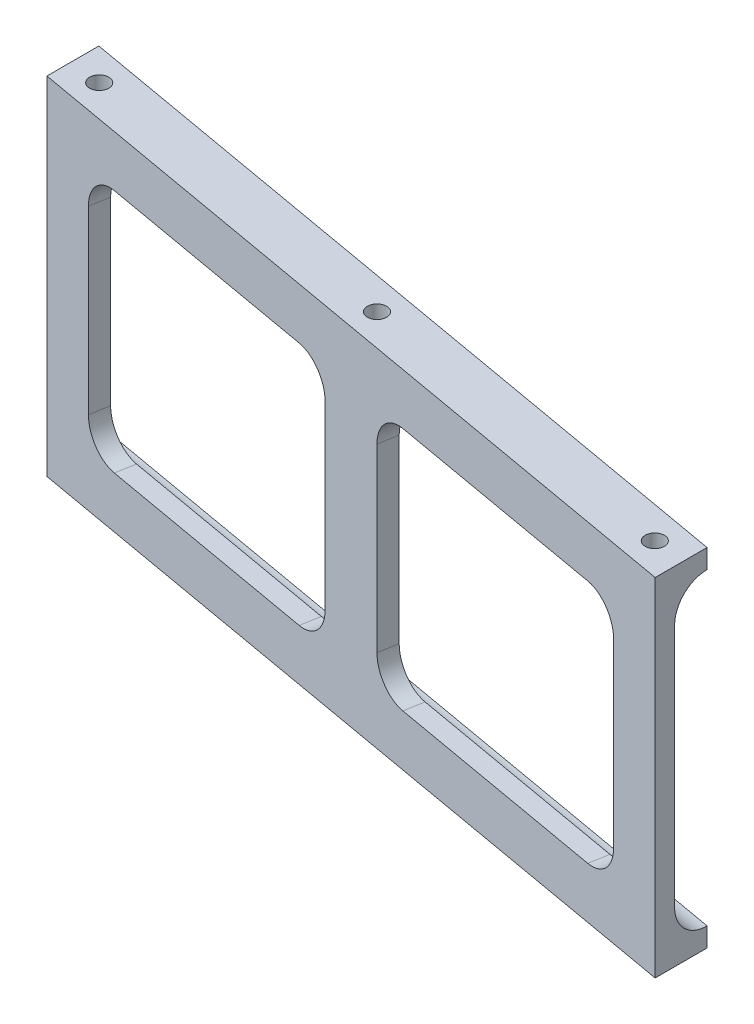
from build123d import *

# Parameters (mm, degrees)
MAIN_BRACKET_EXTRUDE_DEPTH        = 54.25
TOP_SCREWHOLE_EXTENSION_DEPTH     = 3
BOTTOM_SCREWHOLE_EXTENSION_DEPTH  = 3
SCREWHOLE_EXTENSION_FILLETS_5MM_R = 5
SKETCH4_R                         = 1.5
TOP_SCREWHOLES_DEPTH              = 8
BOTTOM_START                      = -8
SKETCH5_R                         = 1.5
BOTTOM_SCREWHOLES_DEPTH           = 8
WEIGHT_REDUCTION_DEPTH            = 88.819886832
WEIGHT_REDUCTION_DEPTH_BACK       = 88.819886832


with BuildPart() as part:
    # Sketch1 → Main bracket extrude (new body)
    with BuildSketch(Plane(origin=(0, -6.84807753, 0), x_dir=(1, 0, 0), z_dir=(0, 1, 0))):
        Polygon((-57.75, -74.492924432), (57.75, -94.858690704), (57.75, -91.812410869), (-57.75, -71.446644597), align=None)
    extrude(amount=MAIN_BRACKET_EXTRUDE_DEPTH)

    # Sketch2 → Top screwhole extension (add)
    with BuildSketch(Plane(origin=(0, 47.40192247, 0), x_dir=(1, 0, 0), z_dir=(0, 1, 0))):
        Polygon((-57.75, -74.492924432), (-57.75, -66.369511537), (57.75, -86.735277809), (57.75, -94.858690704), align=None)
    extrude(amount=-TOP_SCREWHOLE_EXTENSION_DEPTH)

    # Sketch3 → Bottom screwhole extension (add)
    with BuildSketch(Plane.XZ.offset(6.84807753)):
        Polygon((-57.75, 74.492924432), (-57.75, 66.369511537), (57.75, 86.735277809), (57.75, 94.858690704), align=None)
    extrude(amount=-BOTTOM_SCREWHOLE_EXTENSION_DEPTH)

    # Screwhole extension fillets 5mm
    screwhole_extension_fillets_5mm_edges = [part.edges().sort_by_distance(p)[0] for p in [
        (0, 44.40192247, 81.629527733),
        (0, -3.84807753, 81.629527733),
    ]]
    fillet(screwhole_extension_fillets_5mm_edges, radius=SCREWHOLE_EXTENSION_FILLETS_5MM_R - 0.0001)  # a hair under: the kernel refuses the full size

    # Sketch4 → Top screwholes (cut)
    with BuildSketch(Plane(origin=(0, 47.40192247, 0), x_dir=(1, 0, 0), z_dir=(0, 1, 0))):
        with Locations(Location((-52.75, -71.312852888, 0), (0, 0, 270))):
            Circle(SKETCH4_R)
        with Locations(Location((0, -80.614101121, 0), (0, 0, 270))):
            Circle(SKETCH4_R)
        with Locations(Location((52.75, -89.915349353, 0), (0, 0, 270))):
            Circle(SKETCH4_R)
    extrude(amount=-TOP_SCREWHOLES_DEPTH, mode=Mode.SUBTRACT)

    # Sketch5 → Bottom screwholes (cut)
    with BuildSketch(Plane.XZ.offset(6.84807753).offset(BOTTOM_START)):
        with Locations(Location((52.75, 89.915349353, 0), (0, 0, 90))):
            Circle(SKETCH5_R)
        with Locations(Location((0, 80.614101121, 0), (0, 0, 90))):
            Circle(SKETCH5_R)
        with Locations(Location((-52.75, 71.312852888, 0), (0, 0, 90))):
            Circle(SKETCH5_R)
    extrude(amount=BOTTOM_SCREWHOLES_DEPTH, mode=Mode.SUBTRACT)

    # Sketch6 → Weight reduction (cut, two sides: drawn at the far end of the back side and taken through both)
    with BuildSketch(Plane(origin=(-14.48041592, 0, 82.12251955), x_dir=(0.9848077530122094, 0, 0.17364817766692336), z_dir=(-0.17364817766692334, 0, 0.9848077530122092)).offset(-WEIGHT_REDUCTION_DEPTH_BACK)):
        with BuildLine():
            Line((-30.93708716, 39.40192247), (4.703799677, 39.40192247))
            ThreePointArc((4.703799677, 39.40192247), (8.239333583, 37.937456376), (9.703799677, 34.40192247))
            Line((9.703799677, 34.40192247), (9.703799677, 6.15192247))
            ThreePointArc((9.703799677, 6.15192247), (8.239333583, 2.616388564), (4.703799677, 1.15192247))
            Line((4.703799677, 1.15192247), (-30.93708716, 1.15192247))
            ThreePointArc((-30.93708716, 1.15192247), (-34.472621066, 2.616388564), (-35.93708716, 6.15192247))
            Line((-35.93708716, 6.15192247), (-35.93708716, 34.40192247))
            ThreePointArc((-35.93708716, 34.40192247), (-34.472621066, 37.937456376), (-30.93708716, 39.40192247))
        make_face()
        with BuildLine():
            Line((24.703799677, 39.40192247), (60.344686513, 39.40192247))
            ThreePointArc((60.344686513, 39.40192247), (63.880220419, 37.937456376), (65.344686513, 34.40192247))
            Line((65.344686513, 34.40192247), (65.344686513, 6.15192247))
            ThreePointArc((65.344686513, 6.15192247), (63.880220419, 2.616388564), (60.344686513, 1.15192247))
            Line((60.344686513, 1.15192247), (24.703799677, 1.15192247))
            ThreePointArc((24.703799677, 1.15192247), (21.168265771, 2.616388564), (19.703799677, 6.15192247))
            Line((19.703799677, 6.15192247), (19.703799677, 34.40192247))
            ThreePointArc((19.703799677, 34.40192247), (21.168265771, 37.937456376), (24.703799677, 39.40192247))
        make_face()
    extrude(amount=WEIGHT_REDUCTION_DEPTH + WEIGHT_REDUCTION_DEPTH_BACK, mode=Mode.SUBTRACT)


solid = part.part
